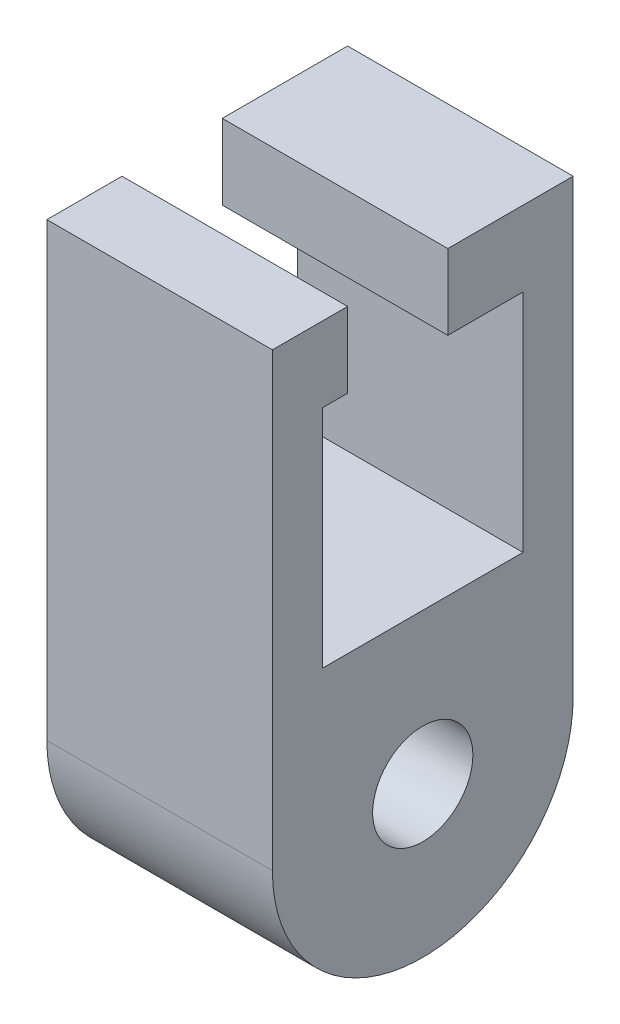
from build123d import *

# Parameters (mm, degrees)
SKETCH1_R           = 50
BOSS_EXTRUDE1_DEPTH = 112.5


with BuildPart() as part:
    # Sketch1 → Boss-Extrude1 (new body)
    with BuildSketch(Plane.YZ):
        with BuildLine():
            Line((0, 150), (450, 150))
            Line((450, 150), (450, 75))
            Line((450, 75), (375, 75))
            Line((375, 75), (375, 100))
            Line((375, 100), (150, 100))
            Line((150, 100), (150, -100))
            Line((150, -100), (375, -100))
            Line((375, -100), (375, -25))
            Line((375, -25), (450, -25))
            Line((450, -25), (450, -150))
            Line((450, -150), (0, -150))
            ThreePointArc((0, -150), (-150, 0), (0, 150))
        make_face()
        Circle(SKETCH1_R, mode=Mode.SUBTRACT)
    extrude(amount=BOSS_EXTRUDE1_DEPTH)

    # Mirror1: part across plane


with BuildPart() as part_1:
    add(part.part)
    add(part.part.mirror(Plane(origin=(0, 0, 0), x_dir=(0, 0, 1), z_dir=(1, 0, 0))))


solid = part_1.part
